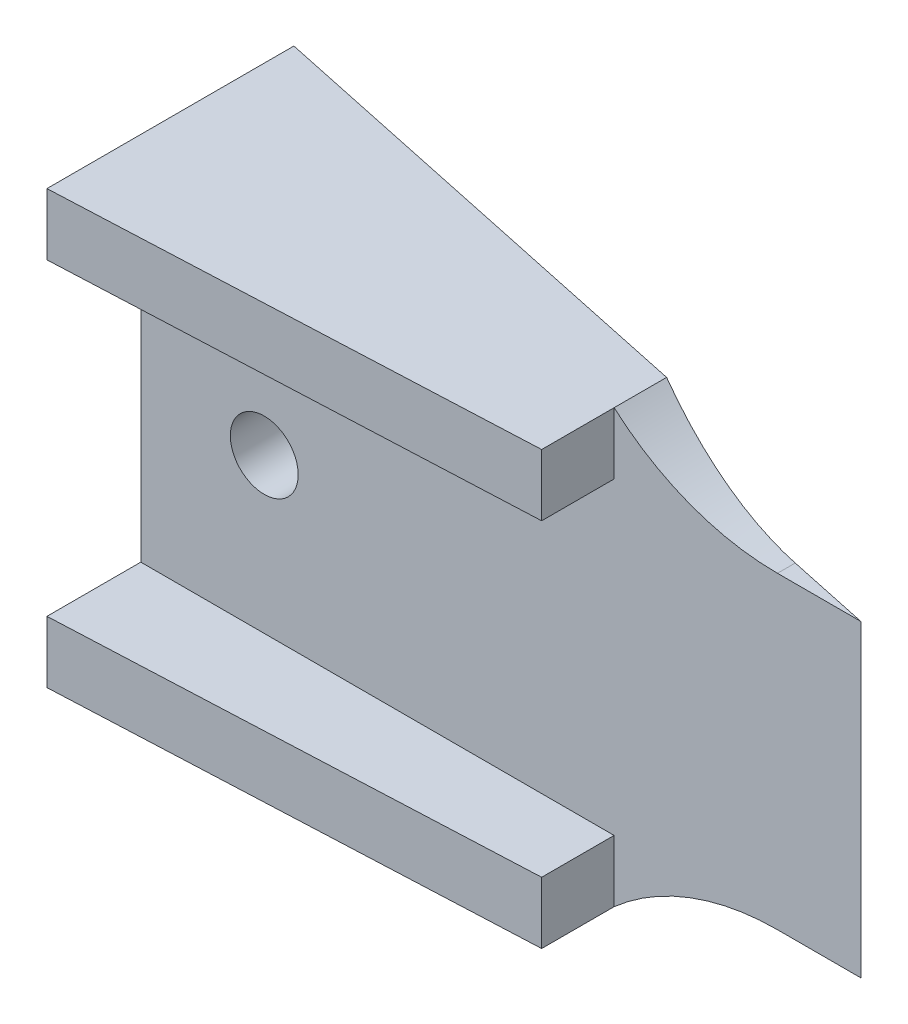
from build123d import *

# Parameters (mm, degrees)
EXTRUDE_1_DEPTH     = 15
SKETCH_3_R          = 6.5
CUT_EXTRUDE_2_DEPTH = 3
SKETCH_4_R          = 1.65
CUT_EXTRUDE_3_DEPTH = 39.336783637
EXTRUDE_2_DEPTH     = 3
FILLET_1_R          = 12


with BuildPart() as part:
    # 草图2 → 凸台-拉伸1 (new body)
    with BuildSketch(Plane(origin=(0, 0, 0), x_dir=(1, 0, 0), z_dir=(0, 1, 0))):
        Polygon((0, 0), (35, 0), (0, 7.439479658), align=None)
    extrude(amount=EXTRUDE_1_DEPTH)

    # 草图3 → 切除-拉伸2 (cut)
    with BuildSketch(Plane.XY.offset(-7.439479658)):
        with Locations((6, 7.5)):
            Circle(SKETCH_3_R)
    extrude(amount=CUT_EXTRUDE_2_DEPTH, mode=Mode.SUBTRACT)

    # 草图4 → 切除-拉伸3 (cut, through all)
    with BuildSketch(Plane(origin=(0, 0, -4.439479658), x_dir=(-1, 0, 0), z_dir=(0, 0, -1))):
        with Locations((-6, 7.5)):
            Circle(SKETCH_4_R)
    extrude(amount=-CUT_EXTRUDE_3_DEPTH, mode=Mode.SUBTRACT)

    # 草图6 → 凸台-拉伸2 (add)
    with BuildSketch(Plane(origin=(0, 15, 0), x_dir=(1, 0, 0), z_dir=(0, 1, 0))):
        Polygon((0, 7.439479658), (0, -4.560520342), (23, -3.520495202), (23, 2.55067874), align=None)
    extrude_2 = extrude(amount=EXTRUDE_2_DEPTH)

    # 镜向1: 凸台-拉伸2 across plane
    add(extrude_2.mirror(Plane(origin=(0, 7.5, 0), x_dir=(0, 0, 1), z_dir=(0, -1, 0))))

    # 圆角1
    # the kernel refuses this fillet: 12 mm, written as the material it adds along each edge
    with BuildSketch(Plane(origin=(23, 0, 0), x_dir=(0, -1, 0), z_dir=(0, 0, -1))) as fillet_1_piece_1_section:
        with BuildLine():
            CenterArc((12, -7.937253933), FILLET_1_R, 138.590377891, 41.409622109)
            Line((0, -7.937253933), (0, 0))
            Line((0, 0), (3, 0))
        make_face()
    fillet_1_piece_1 = extrude(amount=22.393813573, mode=Mode.PRIVATE)
    fillet_1_piece_1 = split(fillet_1_piece_1, bisect_by=Plane(origin=(26.786150339, -0.752577895, -1.745907642), z_dir=(-0.20791169081775981, 0, 0.9781476007338056)), keep=Keep.TOP, mode=Mode.PRIVATE)
    add(fillet_1_piece_1)
    with BuildSketch(Plane(origin=(23, 15, 0), x_dir=(0, 1, 0), z_dir=(0, 0, -1))) as fillet_1_piece_2_section:
        with BuildLine():
            CenterArc((12, 7.937253933), FILLET_1_R, 180, 41.409622109)
            Line((0, 7.937253933), (0, 0))
            Line((0, 0), (3, 0))
        make_face()
    fillet_1_piece_2 = extrude(amount=22.393813573, mode=Mode.PRIVATE)
    fillet_1_piece_2 = split(fillet_1_piece_2, bisect_by=Plane(origin=(26.786150339, 15.752577895, -1.745907642), z_dir=(-0.20791169081775981, 0, 0.9781476007338056)), keep=Keep.TOP, mode=Mode.PRIVATE)
    add(fillet_1_piece_2)


solid = part.part
